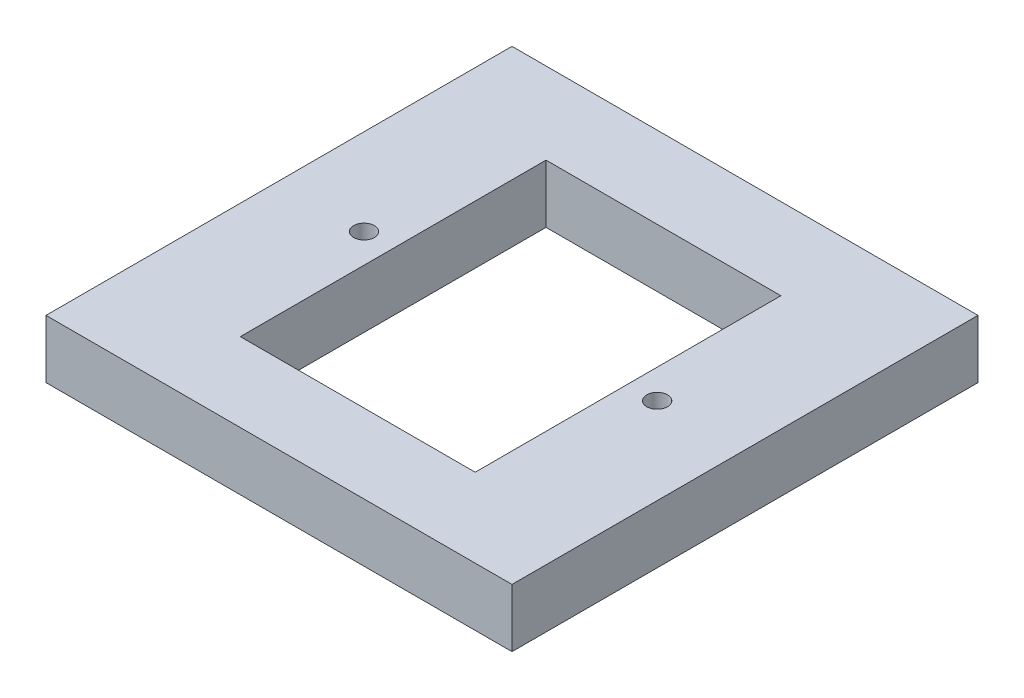
from build123d import *

# Parameters (mm, degrees)
SKETCH1_W           = 50.8
SKETCH1_H           = 50.8
SKETCH1_R           = 1.1303
SKETCH1_W_2         = 25.6032
SKETCH1_H_2         = 33.3248
BOSS_EXTRUDE1_DEPTH = 6.35


with BuildPart() as part:
    # Sketch1 → Boss-Extrude1 (new body)
    with BuildSketch(Plane(origin=(0, 0, 0), x_dir=(1, 0, 0), z_dir=(0, 1, 0))):
        with Locations((21.766538168, 1.940750037)):
            Rectangle(SKETCH1_W, SKETCH1_H)
        with Locations((37.743138168, 1.788350037)):
            Circle(SKETCH1_R, mode=Mode.SUBTRACT)
        with Locations((5.789938168, 1.788350037)):
            Circle(SKETCH1_R, mode=Mode.SUBTRACT)
        with Locations((21.766538168, 1.788350037)):
            Rectangle(SKETCH1_W_2, SKETCH1_H_2, mode=Mode.SUBTRACT)
    extrude(amount=BOSS_EXTRUDE1_DEPTH)


solid = part.part
